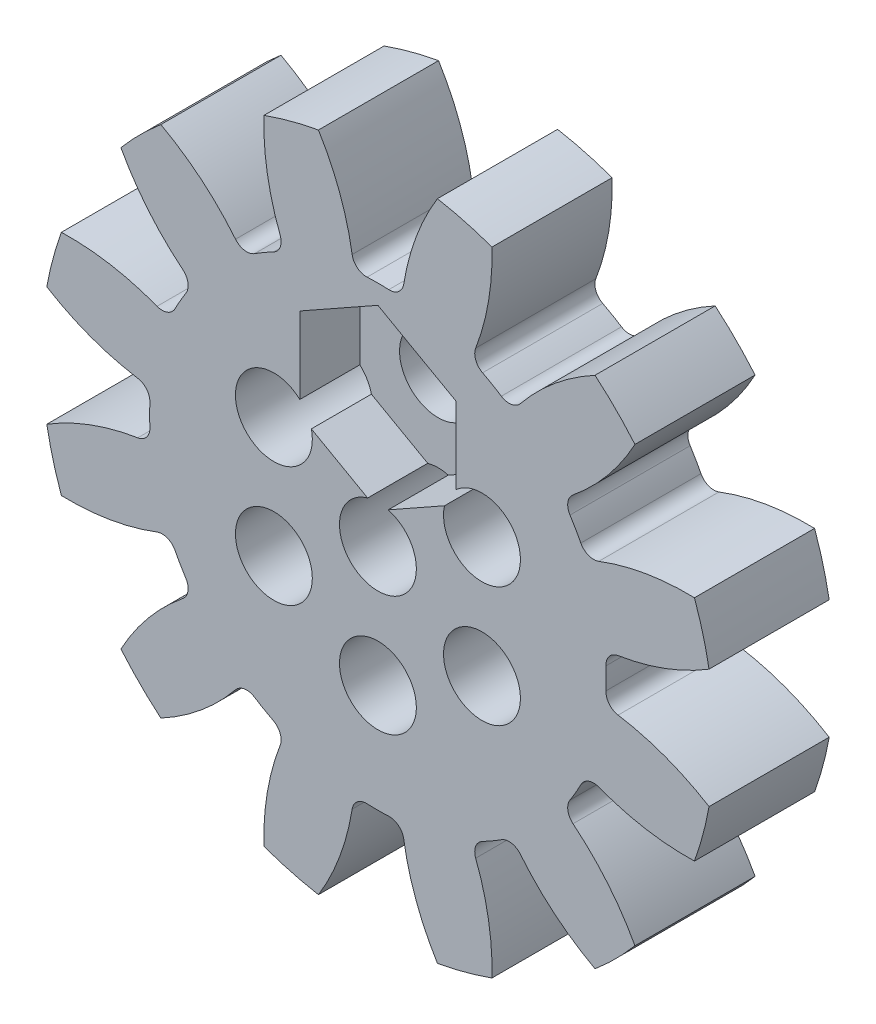
from build123d import *

# Parameters (mm, degrees)
SKETCH1_R                = 14
BOSS_EXTRUDE1_DEPTH      = 2.5
CUT_EXTRUDE1_DEPTH       = 20.956202043
FILLET1_R                = 0.6
FILLET2_R                = 0.6
CIRPATTERN2_COUNT        = 12
FILLET1_OF_CIRPATTERN2_R = 0.6
FILLET2_OF_CIRPATTERN2_R = 0.6
CUT_EXTRUDE2_DEPTH       = 21.118127499
CUT_EXTRUDE2_DEPTH_BACK  = 21.118127499
SKETCH4_R                = 1.5
SKETCH5_R                = 1.6
CUT_EXTRUDE3_DEPTH       = 21.118127499
CUT_EXTRUDE4_DEPTH       = 2.5


with BuildPart() as part:
    # Sketch1 → Boss-Extrude1 (new, symmetric)
    with BuildSketch(Plane.XY):
        Circle(SKETCH1_R)
    extrude(amount=BOSS_EXTRUDE1_DEPTH, both=True)

    # Sketch2 → Cut-Extrude1 (cut, symmetric)
    with BuildSketch(Plane.XY):
        with BuildLine():
            ThreePointArc((-3.314591405, 14.951229823), (-1.751535203, 12.36983933), (-0.999747632, 9.447248524))
            ThreePointArc((-0.999747632, 9.447248524), (0, 9.5), (0.999747632, 9.447248524))
            ThreePointArc((0.999747632, 9.447248524), (1.751535203, 12.36983933), (3.314591405, 14.951229823))
            ThreePointArc((3.314591405, 14.951229823), (0, 15.314234862), (-3.314591405, 14.951229823))
        make_face()
    cut_extrude1 = extrude(amount=CUT_EXTRUDE1_DEPTH, both=True, mode=Mode.SUBTRACT)

    # Fillet1
    fillet1_edges = [part.edges().sort_by_distance(p)[0] for p in [
        (-0.999747632, 9.447248524, 0),
    ]]
    fillet(fillet1_edges, radius=FILLET1_R)

    # Fillet2
    fillet2_edges = [part.edges().sort_by_distance(p)[0] for p in [
        (0.999747632, 9.447248524, 0),
    ]]
    fillet(fillet2_edges, radius=FILLET2_R)

    # CirPattern2: Cut-Extrude1 ×12 about axis
    cirpattern2_axis = Axis((0, 0, 2.5), (0, 0, 1))
    for i in range(1, CIRPATTERN2_COUNT):
        add(cut_extrude1.rotate(cirpattern2_axis, i * 360 / CIRPATTERN2_COUNT), mode=Mode.SUBTRACT)

    # Fillet1 of CirPattern2
    fillet1_of_cirpattern2_edges = [part.edges().sort_by_distance(p)[0] for p in [
        (-5.589431109, 7.681683401, 0),
        (-8.681431034, 3.857817415, 0),
        (-9.447248524, -0.999747632, 0),
        (-7.681683401, -5.589431109, 0),
        (-3.857817415, -8.681431034, 0),
        (0.999747632, -9.447248524, 0),
        (5.589431109, -7.681683401, 0),
        (8.681431034, -3.857817415, 0),
        (9.447248524, 0.999747632, 0),
        (7.681683401, 5.589431109, 0),
        (3.857817415, 8.681431034, 0),
    ]]
    fillet(fillet1_of_cirpattern2_edges, radius=FILLET1_OF_CIRPATTERN2_R)

    # Fillet2 of CirPattern2
    fillet2_of_cirpattern2_edges = [part.edges().sort_by_distance(p)[0] for p in [
        (-3.857817415, 8.681431034, 0),
        (-7.681683401, 5.589431109, 0),
        (-9.447248524, 0.999747632, 0),
        (-8.681431034, -3.857817415, 0),
        (-5.589431109, -7.681683401, 0),
        (-0.999747632, -9.447248524, 0),
        (3.857817415, -8.681431034, 0),
        (7.681683401, -5.589431109, 0),
        (9.447248524, -0.999747632, 0),
        (8.681431034, 3.857817415, 0),
        (5.589431109, 7.681683401, 0),
    ]]
    fillet(fillet2_of_cirpattern2_edges, radius=FILLET2_OF_CIRPATTERN2_R)

    # Sketch4 → Cut-Extrude2 (cut, two sides: drawn at the far end of the back side and taken through both)
    with BuildSketch(Plane.XY.offset(2.5).offset(-CUT_EXTRUDE2_DEPTH_BACK)):
        Circle(SKETCH4_R)
        with Locations((0, 5)):
            Circle(SKETCH4_R)
        with Locations((4.330127019, 2.5)):
            Circle(SKETCH4_R)
        with Locations((4.330127019, -2.5)):
            Circle(SKETCH4_R)
        with Locations((0, -5)):
            Circle(SKETCH4_R)
        with Locations((-4.330127019, -2.5)):
            Circle(SKETCH4_R)
        with Locations((-4.330127019, 2.5)):
            Circle(SKETCH4_R)
    extrude(amount=CUT_EXTRUDE2_DEPTH + CUT_EXTRUDE2_DEPTH_BACK, mode=Mode.SUBTRACT)

    # Sketch5 → Cut-Extrude3 (cut, through all)
    with BuildSketch(Plane.XY.offset(2.5)):
        with Locations((0, 5)):
            Circle(SKETCH5_R)
        with Locations((4.330127019, 2.5)):
            Circle(SKETCH5_R)
        with Locations((4.330127019, -2.5)):
            Circle(SKETCH5_R)
        with Locations((0, -5)):
            Circle(SKETCH5_R)
        Circle(SKETCH5_R)
        with Locations((-4.330127019, -2.5)):
            Circle(SKETCH5_R)
        with Locations((-4.330127019, 2.5)):
            Circle(SKETCH5_R)
    extrude(amount=-CUT_EXTRUDE3_DEPTH, mode=Mode.SUBTRACT)

    # Sketch6 → Cut-Extrude4 (cut)
    with BuildSketch(Plane.XY.offset(2.5)):
        Polygon((-3.25, 3.129909516), (0, 1.30128887), (3.25, 3.129909516), (3.25, 6.870090484), (0, 8.69871113), (-3.25, 6.870090484), align=None)
    extrude(amount=-CUT_EXTRUDE4_DEPTH, mode=Mode.SUBTRACT)


solid = part.part
